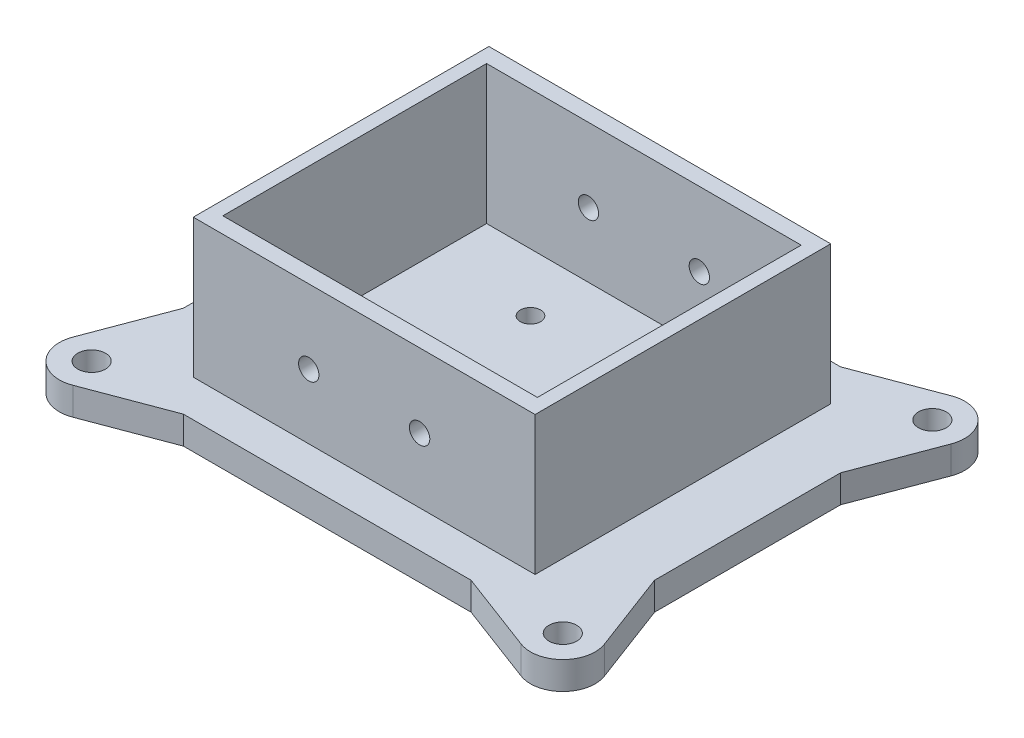
from build123d import *

# Parameters (mm, degrees)
SKETCH1_R               = 1.5
BOSS_EXTRUDE2_DEPTH     = 3
SKETCH2_W               = 37
SKETCH2_H               = 32
SKETCH2_W_2             = 34.05
SKETCH2_H_2             = 28.55
BOSS_EXTRUDE3_DEPTH     = 15
CUT_EXTRUDE1_DEPTH      = 40
CUT_EXTRUDE1_DEPTH_BACK = 11
SKETCH3_R               = 1.1
SKETCH2_4_R             = 1.1
CUT_EXTRUDE2_DEPTH      = 11


with BuildPart() as part:
    # Sketch1 → Boss-Extrude2 (new body)
    with BuildSketch(Plane(origin=(0, 0, 0), x_dir=(1, 0, 0), z_dir=(0, 1, 0))):
        with BuildLine():
            Line((-24.266499455, 23.2754353), (-15.568913997, 20))
            Line((-15.568913997, 20), (15.568913997, 20))
            Line((15.568913997, 20), (24.266499455, 23.2754353))
            ThreePointArc((24.266499455, 23.2754353), (27.974873734, 22.474873734), (28.7754353, 18.766499455))
            Line((28.7754353, 18.766499455), (25.5, 10.068913997))
            Line((25.5, 10.068913997), (25.5, -10.068913997))
            Line((25.5, -10.068913997), (28.7754353, -18.766499455))
            ThreePointArc((28.7754353, -18.766499455), (27.974873734, -22.474873734), (24.266499455, -23.2754353))
            Line((24.266499455, -23.2754353), (15.568913997, -20))
            Line((15.568913997, -20), (-15.568913997, -20))
            Line((-15.568913997, -20), (-24.266499455, -23.2754353))
            ThreePointArc((-24.266499455, -23.2754353), (-27.974873734, -22.474873734), (-28.7754353, -18.766499455))
            Line((-28.7754353, -18.766499455), (-25.5, -10.068913997))
            Line((-25.5, -10.068913997), (-25.5, 10.068913997))
            Line((-25.5, 10.068913997), (-28.7754353, 18.766499455))
            ThreePointArc((-28.7754353, 18.766499455), (-27.974873734, 22.474873734), (-24.266499455, 23.2754353))
        make_face()
        with Locations((-25.5, 20)):
            Circle(SKETCH1_R, mode=Mode.SUBTRACT)
        with Locations((25.5, 20)):
            Circle(SKETCH1_R, mode=Mode.SUBTRACT)
        with Locations((25.5, -20)):
            Circle(SKETCH1_R, mode=Mode.SUBTRACT)
        with Locations((-25.5, -20)):
            Circle(SKETCH1_R, mode=Mode.SUBTRACT)
    extrude(amount=BOSS_EXTRUDE2_DEPTH)

    # Sketch2 → Boss-Extrude3 (add)
    with BuildSketch(Plane(origin=(0, 3, 0), x_dir=(1, 0, 0), z_dir=(0, 1, 0))):
        Rectangle(SKETCH2_W, SKETCH2_H)
        Rectangle(SKETCH2_W_2, SKETCH2_H_2, mode=Mode.SUBTRACT)
    extrude(amount=BOSS_EXTRUDE3_DEPTH)

    # Sketch3 → Cut-Extrude1 (cut, two sides: drawn at the far end of the back side and taken through both)
    with BuildSketch(Plane.XY.offset(-14.275).offset(-CUT_EXTRUDE1_DEPTH_BACK)):
        with Locations((-6, 10)):
            Circle(SKETCH3_R)
        with Locations((6, 10)):
            Circle(SKETCH3_R)
    extrude(amount=CUT_EXTRUDE1_DEPTH + CUT_EXTRUDE1_DEPTH_BACK, mode=Mode.SUBTRACT)

    # Sketch2<4> → Cut-Extrude2 (cut)
    with BuildSketch(Plane(origin=(0, 3, 0), x_dir=(1, 0, 0), z_dir=(0, 1, 0))):
        with Locations((-6, 8)):
            Circle(SKETCH2_4_R)
        with Locations((6, 8)):
            Circle(SKETCH2_4_R)
        with Locations((6, -8)):
            Circle(SKETCH2_4_R)
        with Locations((-6, -8)):
            Circle(SKETCH2_4_R)
    extrude(amount=-CUT_EXTRUDE2_DEPTH, mode=Mode.SUBTRACT)


solid = part.part
